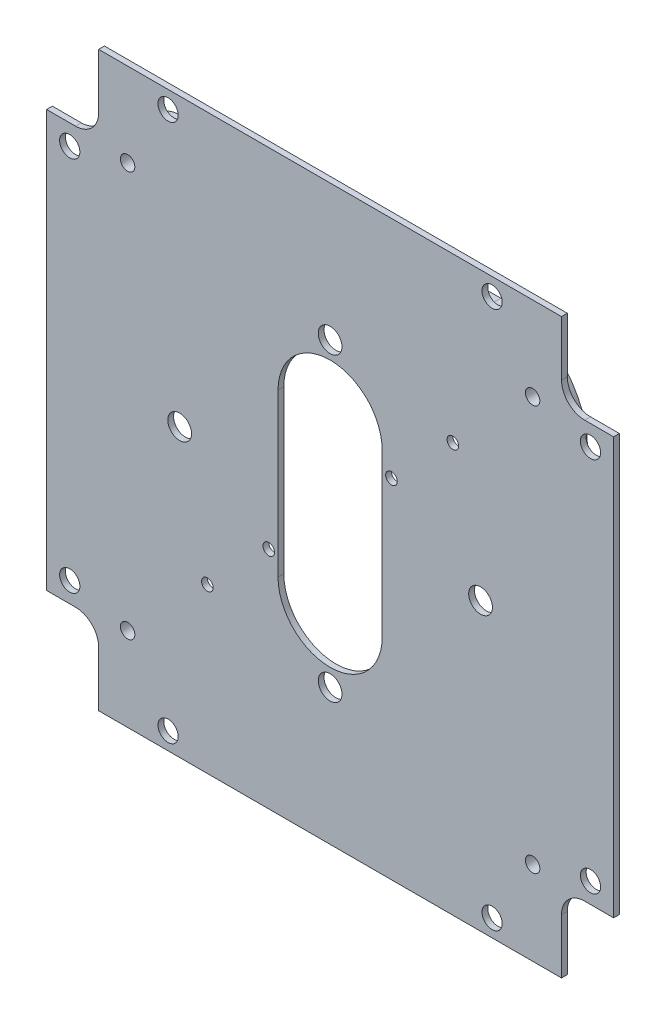
from build123d import *

# Parameters (mm, degrees)
SKETCH1_W                      = 98
SKETCH1_H                      = 99
MAIN_BODY_DEPTH                = 1
SKETCH2_R                      = 1.75
FRONTBACKBOLTHOLES_DEPTH       = 140.305419851
SKETCH3_R                      = 1.75
SIDEBOLTHOLES_DEPTH            = 140.305419851
SKETCH7_W                      = 9
SKETCH7_H                      = 13.5
CUT_EXTRUDE3_DEPTH             = 140.305419851
FILLET1_R                      = 4
BOSS_EXTRUDE4_DEPTH            = 2
CAMERAVIEWHOLE_DEPTH           = 140.334130779
M3X0_5_TAPPED_HOLE1_D          = 2.5
M3X0_5_TAPPED_HOLE1_DEPTH      = 7.5
M3X0_5_TAPPED_HOLE1_TIP        = 0.751075774
SKETCH16_R                     = 1
WIREPASSTHROUGHS_DEPTH         = 140.334130779
SKETCH17_R                     = 2.05
NOTSUREIFNEEDPASSTHROUGH_DEPTH = 140.334130779


with BuildPart() as part:
    # Sketch1 → Main Body (new body)
    with BuildSketch(Plane.XY):
        with Locations((49, 49.5)):
            Rectangle(SKETCH1_W, SKETCH1_H)
    extrude(amount=MAIN_BODY_DEPTH)

    # Sketch2 → FrontBackBoltHoles (cut, through all)
    with BuildSketch(Plane.XY.offset(1)):
        with Locations((4, 82)):
            Circle(SKETCH2_R)
        with Locations((94, 82)):
            Circle(SKETCH2_R)
        with Locations((94, 17)):
            Circle(SKETCH2_R)
        with Locations((4, 17)):
            Circle(SKETCH2_R)
    extrude(amount=-FRONTBACKBOLTHOLES_DEPTH, mode=Mode.SUBTRACT)

    # Sketch3 → SideBoltHoles (cut, through all)
    with BuildSketch(Plane.XY.offset(1)):
        with Locations((21, 96)):
            Circle(SKETCH3_R)
        with Locations((77, 96)):
            Circle(SKETCH3_R)
        with Locations((77, 3)):
            Circle(SKETCH3_R)
        with Locations((21, 3)):
            Circle(SKETCH3_R)
    extrude(amount=-SIDEBOLTHOLES_DEPTH, mode=Mode.SUBTRACT)

    # Sketch7 → Cut-Extrude3 (cut, through all)
    with BuildSketch(Plane.XY.offset(1)):
        with Locations((4.5, 92.25)):
            Rectangle(SKETCH7_W, SKETCH7_H)
        with Locations((93.5, 92.25)):
            Rectangle(SKETCH7_W, SKETCH7_H)
        with Locations((93.5, 6.75)):
            Rectangle(SKETCH7_W, SKETCH7_H)
        with Locations((4.5, 6.75)):
            Rectangle(SKETCH7_W, SKETCH7_H)
    extrude(amount=-CUT_EXTRUDE3_DEPTH, mode=Mode.SUBTRACT)

    # Fillet1
    fillet1_edges = [part.edges().sort_by_distance(p)[0] for p in [
        (89, 85.5, 0.5),
        (9, 13.5, 0.5),
        (89, 13.5, 0.5),
        (9, 85.5, 0.5),
    ]]
    fillet(fillet1_edges, radius=FILLET1_R)

    # Sketch15 → Boss-Extrude4 (add)
    with BuildSketch(Plane(origin=(0, 0, 0), x_dir=(-1, 0, 0), z_dir=(0, 0, -1))):
        with BuildLine():
            Line((-22.5, 93.5), (-75.5, 93.5))
            ThreePointArc((-75.5, 93.5), (-86.106601718, 89.106601718), (-90.5, 78.5))
            Line((-90.5, 78.5), (-90.5, 20.5))
            ThreePointArc((-90.5, 20.5), (-86.106601718, 9.893398282), (-75.5, 5.5))
            Line((-75.5, 5.5), (-22.5, 5.5))
            ThreePointArc((-22.5, 5.5), (-11.893398282, 9.893398282), (-7.5, 20.5))
            Line((-7.5, 20.5), (-7.5, 78.5))
            ThreePointArc((-7.5, 78.5), (-11.893398282, 89.106601718), (-22.5, 93.5))
        make_face()
        with BuildLine():
            Line((-35.5, 90.5), (-62.5, 90.5))
            ThreePointArc((-62.5, 90.5), (-80.17766953, 83.17766953), (-87.5, 65.5))
            Line((-87.5, 65.5), (-87.5, 33.5))
            ThreePointArc((-87.5, 33.5), (-80.17766953, 15.82233047), (-62.5, 8.5))
            Line((-62.5, 8.5), (-35.5, 8.5))
            ThreePointArc((-35.5, 8.5), (-17.82233047, 15.82233047), (-10.5, 33.5))
            Line((-10.5, 33.5), (-10.5, 65.5))
            ThreePointArc((-10.5, 65.5), (-17.82233047, 83.17766953), (-35.5, 90.5))
        make_face(mode=Mode.SUBTRACT)
    extrude(amount=BOSS_EXTRUDE4_DEPTH)

    # Sketch10 → CameraViewHole (cut, through all)
    with BuildSketch(Plane.XY.offset(1)):
        with BuildLine():
            Line((40, 35.5), (40, 63.5))
            ThreePointArc((40, 63.5), (49, 72.5), (58, 63.5))
            Line((58, 63.5), (58, 35.5))
            ThreePointArc((58, 35.5), (49, 26.5), (40, 35.5))
        make_face()
    extrude(amount=-CAMERAVIEWHOLE_DEPTH, mode=Mode.SUBTRACT)

    # M3x0.5 Tapped Hole1
    with Locations(Plane.XY.offset(1)):
        with Locations((84, 14.5), (14, 14.5), (14, 84.5), (84, 84.5)):
            Hole(M3X0_5_TAPPED_HOLE1_D / 2, depth=M3X0_5_TAPPED_HOLE1_DEPTH)
            with Locations((0, 0, -(M3X0_5_TAPPED_HOLE1_DEPTH + M3X0_5_TAPPED_HOLE1_TIP / 2))):  # 118° drill point
                Cone(0, M3X0_5_TAPPED_HOLE1_D / 2, M3X0_5_TAPPED_HOLE1_TIP, mode=Mode.SUBTRACT)

    # Sketch16 → WirePassthroughs (cut, through all)
    with BuildSketch(Plane.XY.offset(1)):
        with Locations((27.787, 28.287)):
            Circle(SKETCH16_R)
        with Locations((38.393, 38.893)):
            Circle(SKETCH16_R)
        with Locations((59.607, 60.107)):
            Circle(SKETCH16_R)
        with Locations((70.213, 70.713)):
            Circle(SKETCH16_R)
    extrude(amount=-WIREPASSTHROUGHS_DEPTH, mode=Mode.SUBTRACT)

    # Sketch17 → NotSureIfNeedPassthrough (cut, through all)
    with BuildSketch(Plane.XY.offset(1)):
        with Locations((49, 23.5)):
            Circle(SKETCH17_R)
        with Locations((23, 49.5)):
            Circle(SKETCH17_R)
        with Locations((49, 75.5)):
            Circle(SKETCH17_R)
        with Locations((75, 49.5)):
            Circle(SKETCH17_R)
    extrude(amount=-NOTSUREIFNEEDPASSTHROUGH_DEPTH, mode=Mode.SUBTRACT)


solid = part.part
